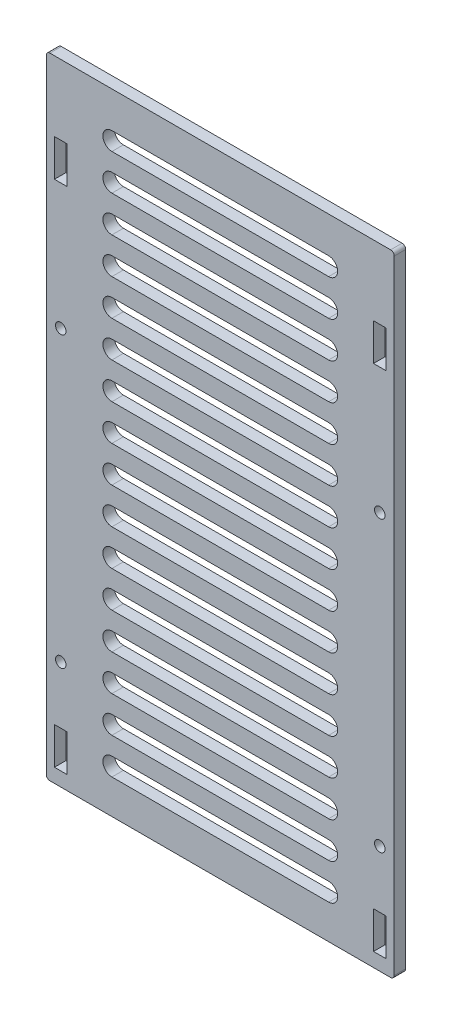
from build123d import *

# Parameters (mm, degrees)
STOCK_TORSO_REAR_PLATE_1_START       = -1.5875
STOCK_TORSO_REAR_PLATE_1_OUTLINE_W   = 96.34
STOCK_TORSO_REAR_PLATE_1_OUTLINE_H   = 174.5
STOCK_TORSO_REAR_PLATE_1_OUTLINE_W_2 = 3.4925
STOCK_TORSO_REAR_PLATE_1_OUTLINE_H_2 = 10.25
STOCK_TORSO_REAR_PLATE_1_OUTLINE_R   = 1.45
STOCK_TORSO_REAR_PLATE_1_DEPTH       = 3.175
FILLET1_R                            = 1


# Read off the part's stored shape, not the designer's step: Stock-torso_rear_plate-1
with BuildPart() as part:
    # Stock-torso_rear_plate-1 outline → Stock-torso_rear_plate-1 (new body)
    with BuildSketch(Plane.XY.offset(STOCK_TORSO_REAR_PLATE_1_START)):
        with Locations((0, -62.75)):
            Rectangle(STOCK_TORSO_REAR_PLATE_1_OUTLINE_W, STOCK_TORSO_REAR_PLATE_1_OUTLINE_H)
        with Locations((-44.17, -141)):
            Rectangle(STOCK_TORSO_REAR_PLATE_1_OUTLINE_W_2, STOCK_TORSO_REAR_PLATE_1_OUTLINE_H_2, mode=Mode.SUBTRACT)
        with Locations((-44.17, -120)):
            Circle(STOCK_TORSO_REAR_PLATE_1_OUTLINE_R, mode=Mode.SUBTRACT)
        with BuildLine():
            Line((30, -140.5), (-30, -140.5))
            ThreePointArc((-30, -140.5), (-32.5, -138), (-30, -135.5))
            Line((-30, -135.5), (30, -135.5))
            ThreePointArc((30, -135.5), (32.5, -138), (30, -140.5))
        make_face(mode=Mode.SUBTRACT)
        with BuildLine():
            Line((30, -130.5), (-30, -130.5))
            ThreePointArc((-30, -130.5), (-32.5, -128), (-30, -125.5))
            Line((-30, -125.5), (30, -125.5))
            ThreePointArc((30, -125.5), (32.5, -128), (30, -130.5))
        make_face(mode=Mode.SUBTRACT)
        with BuildLine():
            Line((30, -120.5), (-30, -120.5))
            ThreePointArc((-30, -120.5), (-32.5, -118), (-30, -115.5))
            Line((-30, -115.5), (30, -115.5))
            ThreePointArc((30, -115.5), (32.5, -118), (30, -120.5))
        make_face(mode=Mode.SUBTRACT)
        with BuildLine():
            Line((30, -110.5), (-30, -110.5))
            ThreePointArc((-30, -110.5), (-32.5, -108), (-30, -105.5))
            Line((-30, -105.5), (30, -105.5))
            ThreePointArc((30, -105.5), (32.5, -108), (30, -110.5))
        make_face(mode=Mode.SUBTRACT)
        with Locations((44.17, -141)):
            Rectangle(STOCK_TORSO_REAR_PLATE_1_OUTLINE_W_2, STOCK_TORSO_REAR_PLATE_1_OUTLINE_H_2, mode=Mode.SUBTRACT)
        with Locations((44.17, -120)):
            Circle(STOCK_TORSO_REAR_PLATE_1_OUTLINE_R, mode=Mode.SUBTRACT)
        with BuildLine():
            Line((30, -100.5), (-30, -100.5))
            ThreePointArc((-30, -100.5), (-32.5, -98), (-30, -95.5))
            Line((-30, -95.5), (30, -95.5))
            ThreePointArc((30, -95.5), (32.5, -98), (30, -100.5))
        make_face(mode=Mode.SUBTRACT)
        with BuildLine():
            Line((30, -90.5), (-30, -90.5))
            ThreePointArc((-30, -90.5), (-32.5, -88), (-30, -85.5))
            Line((-30, -85.5), (30, -85.5))
            ThreePointArc((30, -85.5), (32.5, -88), (30, -90.5))
        make_face(mode=Mode.SUBTRACT)
        with BuildLine():
            Line((30, -80.5), (-30, -80.5))
            ThreePointArc((-30, -80.5), (-32.5, -78), (-30, -75.5))
            Line((-30, -75.5), (30, -75.5))
            ThreePointArc((30, -75.5), (32.5, -78), (30, -80.5))
        make_face(mode=Mode.SUBTRACT)
        with BuildLine():
            Line((30, -70.5), (-30, -70.5))
            ThreePointArc((-30, -70.5), (-32.5, -68), (-30, -65.5))
            Line((-30, -65.5), (30, -65.5))
            ThreePointArc((30, -65.5), (32.5, -68), (30, -70.5))
        make_face(mode=Mode.SUBTRACT)
        with Locations((-44.17, -40)):
            Circle(STOCK_TORSO_REAR_PLATE_1_OUTLINE_R, mode=Mode.SUBTRACT)
        with Locations((-44.17, 0)):
            Rectangle(STOCK_TORSO_REAR_PLATE_1_OUTLINE_W_2, STOCK_TORSO_REAR_PLATE_1_OUTLINE_H_2, mode=Mode.SUBTRACT)
        with BuildLine():
            Line((30, -60.5), (-30, -60.5))
            ThreePointArc((-30, -60.5), (-32.5, -58), (-30, -55.5))
            Line((-30, -55.5), (30, -55.5))
            ThreePointArc((30, -55.5), (32.5, -58), (30, -60.5))
        make_face(mode=Mode.SUBTRACT)
        with BuildLine():
            Line((30, -50.5), (-30, -50.5))
            ThreePointArc((-30, -50.5), (-32.5, -48), (-30, -45.5))
            Line((-30, -45.5), (30, -45.5))
            ThreePointArc((30, -45.5), (32.5, -48), (30, -50.5))
        make_face(mode=Mode.SUBTRACT)
        with BuildLine():
            Line((30, -40.5), (-30, -40.5))
            ThreePointArc((-30, -40.5), (-32.5, -38), (-30, -35.5))
            Line((-30, -35.5), (30, -35.5))
            ThreePointArc((30, -35.5), (32.5, -38), (30, -40.5))
        make_face(mode=Mode.SUBTRACT)
        with BuildLine():
            Line((30, -30.5), (-30, -30.5))
            ThreePointArc((-30, -30.5), (-32.5, -28), (-30, -25.5))
            Line((-30, -25.5), (30, -25.5))
            ThreePointArc((30, -25.5), (32.5, -28), (30, -30.5))
        make_face(mode=Mode.SUBTRACT)
        with Locations((44.17, -40)):
            Circle(STOCK_TORSO_REAR_PLATE_1_OUTLINE_R, mode=Mode.SUBTRACT)
        with BuildLine():
            Line((30, -20.5), (-30, -20.5))
            ThreePointArc((-30, -20.5), (-32.5, -18), (-30, -15.5))
            Line((-30, -15.5), (30, -15.5))
            ThreePointArc((30, -15.5), (32.5, -18), (30, -20.5))
        make_face(mode=Mode.SUBTRACT)
        with BuildLine():
            Line((30, -10.5), (-30, -10.5))
            ThreePointArc((-30, -10.5), (-32.5, -8), (-30, -5.5))
            Line((-30, -5.5), (30, -5.5))
            ThreePointArc((30, -5.5), (32.5, -8), (30, -10.5))
        make_face(mode=Mode.SUBTRACT)
        with BuildLine():
            Line((-30, 4.5), (30, 4.5))
            ThreePointArc((30, 4.5), (32.5, 2), (30, -0.5))
            Line((30, -0.5), (-30, -0.5))
            ThreePointArc((-30, -0.5), (-32.5, 2), (-30, 4.5))
        make_face(mode=Mode.SUBTRACT)
        with BuildLine():
            Line((-30, 14.5), (30, 14.5))
            ThreePointArc((30, 14.5), (32.5, 12), (30, 9.5))
            Line((30, 9.5), (-30, 9.5))
            ThreePointArc((-30, 9.5), (-32.5, 12), (-30, 14.5))
        make_face(mode=Mode.SUBTRACT)
        with Locations((44.17, 0)):
            Rectangle(STOCK_TORSO_REAR_PLATE_1_OUTLINE_W_2, STOCK_TORSO_REAR_PLATE_1_OUTLINE_H_2, mode=Mode.SUBTRACT)
    extrude(amount=STOCK_TORSO_REAR_PLATE_1_DEPTH)

    # Fillet1
    fillet1_edges = [part.edges().sort_by_distance(p)[0] for p in [
        (-48.17, 24.5, 0),
        (48.17, 24.5, 0),
        (48.17, -150, 0),
        (-48.17, -150, 0),
    ]]
    fillet(fillet1_edges, radius=FILLET1_R)


solid = part.part
